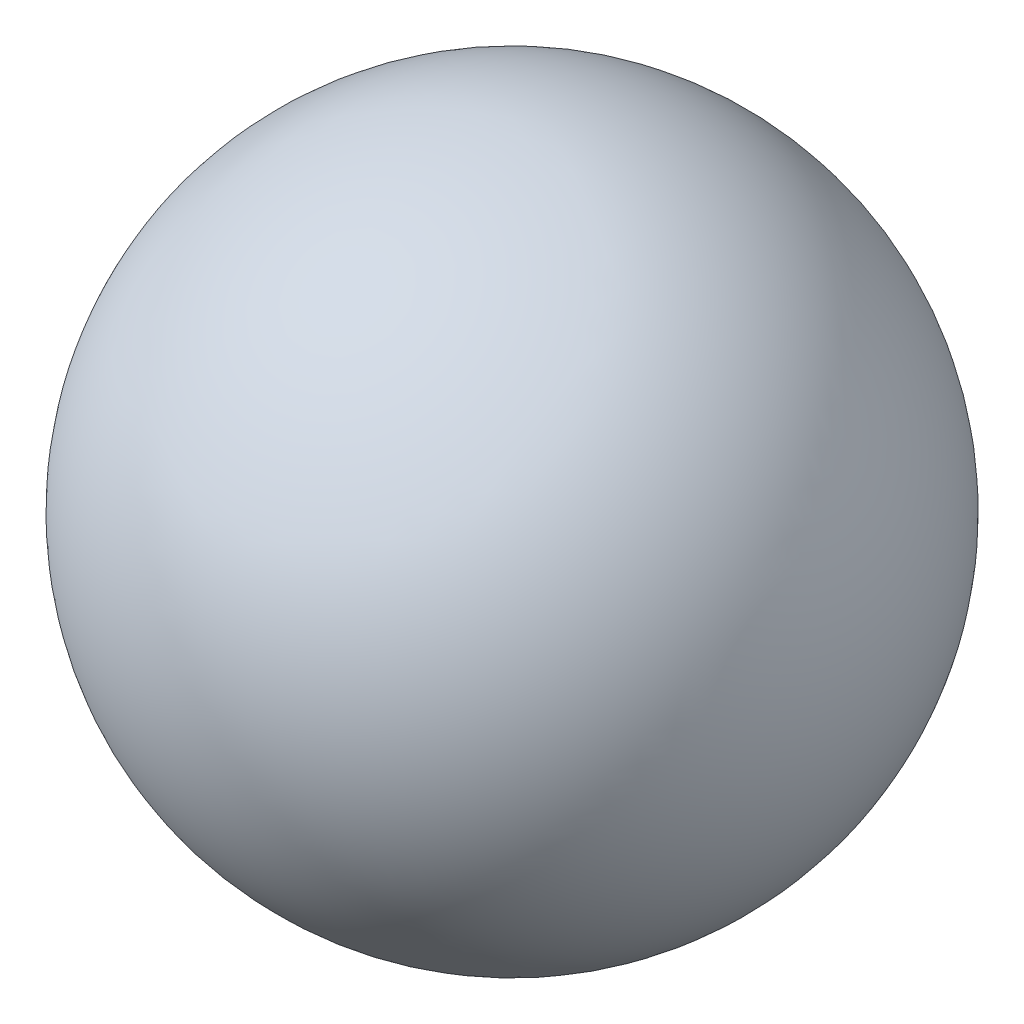
from build123d import *


with BuildPart() as part:
    # Sketch1 → Revolve1 (revolve)
    with BuildSketch(Plane.XY):
        with BuildLine():
            Line((0.24, 0), (-0.24, 0))
            ThreePointArc((-0.24, 0), (0, 0.24), (0.24, 0))
        make_face()
    revolve(axis=Axis((0.24, 0, 0), (-1, 0, 0)))


solid = part.part
